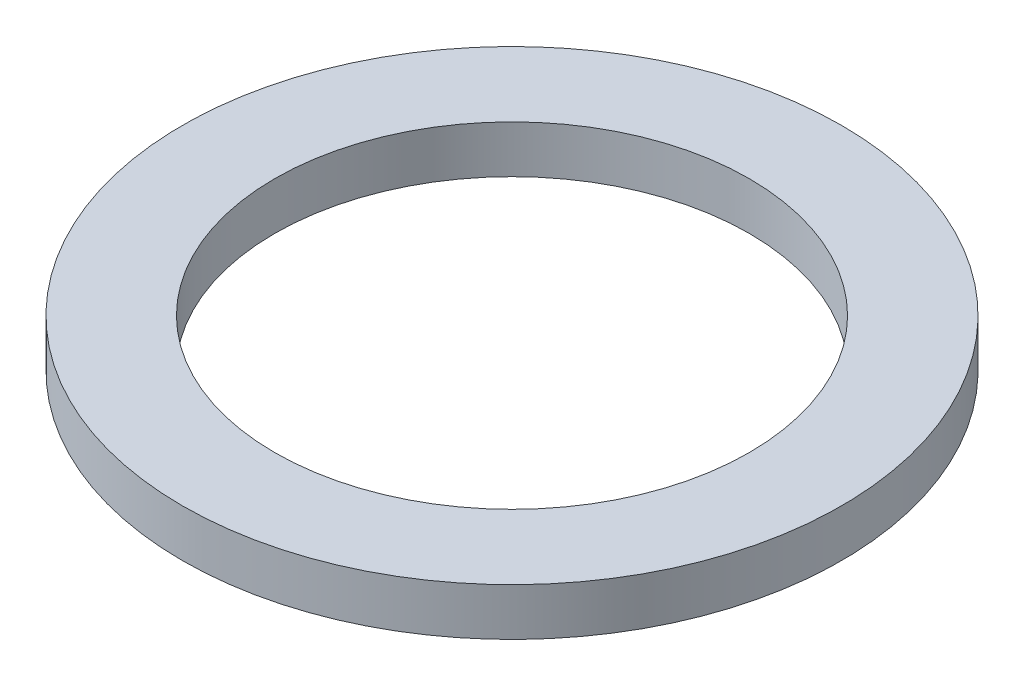
from build123d import *

# Parameters (mm, degrees)
SKETCH1_R           = 62.5
BOSS_EXTRUDE1_DEPTH = 9
SKETCH2_R           = 45
CUT_EXTRUDE1_DEPTH  = 89.845371292


with BuildPart() as part:
    # Sketch1 → Boss-Extrude1 (new body)
    with BuildSketch(Plane(origin=(0, 0, 0), x_dir=(1, 0, 0), z_dir=(0, 1, 0))):
        Circle(SKETCH1_R)
    extrude(amount=BOSS_EXTRUDE1_DEPTH)

    # Sketch2 → Cut-Extrude1 (cut, through all)
    with BuildSketch(Plane(origin=(0, 0, 0), x_dir=(1, 0, 0), z_dir=(0, 1, 0))):
        Circle(SKETCH2_R)
    extrude(amount=CUT_EXTRUDE1_DEPTH, mode=Mode.SUBTRACT)


solid = part.part
